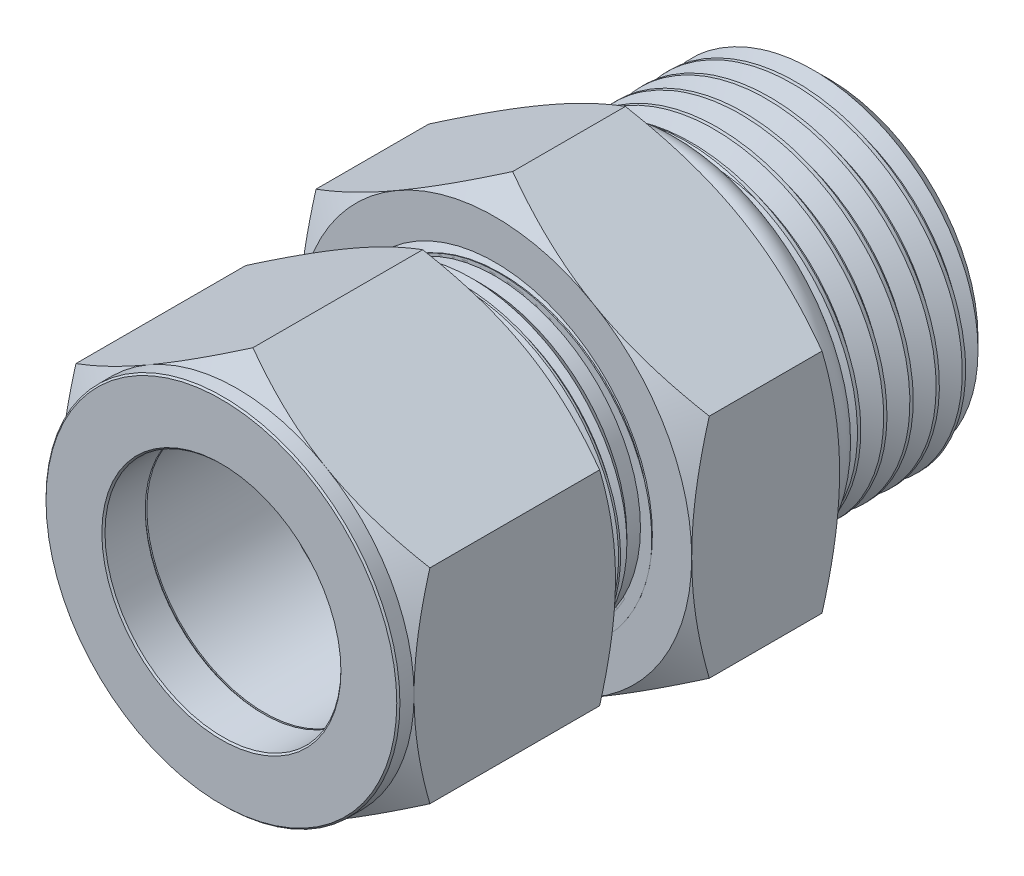
from build123d import *
from build123d.topology import SkipClean

# Parameters (mm, degrees)
BOSS_EXTRUDE1_DEPTH = 17.526
CHAMFER1_SIZE       = 0.127
SKETCH4_W           = 23.876
SKETCH4_H           = 12.7
BOSS_EXTRUDE2_DEPTH = 11.938
SKETCH11_W          = 14.986
SKETCH11_H          = 13.49375
SKETCH15_R          = 1.4732
SKETCH17_OUTSIDE_W  = 195.774
SKETCH17_OUTSIDE_H  = 200.686
SKETCH17_OUTSIDE_R  = 15.875
CUT_EXTRUDE1_DEPTH  = 42.790976949
CUT_EXTRUDE1_DRAFT  = -60
SKETCH18_OUTSIDE_W  = 176.526
SKETCH18_OUTSIDE_H  = 181.438
SKETCH18_OUTSIDE_R  = 15.875
CUT_EXTRUDE2_DEPTH  = 37.234489569
CUT_EXTRUDE2_DRAFT  = -60
CHAMFER2_SIZE       = 1.42875
CUT_SWEEP1_PITCH    = 1.27
CUT_SWEEP2_PITCH    = 2.116666667
SKETCH19_W          = 11.938
SKETCH19_H          = 0.824889197


with BuildPart() as part:
    # Sketch2 → Boss-Extrude1 (new body)
    with BuildSketch(Plane.XY):
        Polygon((0, 16.497783942), (-14.2875, 8.248891971), (-14.2875, -8.248891971), (0, -16.497783942), (14.2875, -8.248891971), (14.2875, 8.248891971), align=None)
    extrude(amount=-BOSS_EXTRUDE1_DEPTH)

    # Sketch3 → Cut-Revolve1 (revolve, cut)
    with BuildSketch(Plane(origin=(0, 0, 0), x_dir=(0, 0, -1), z_dir=(1, 0, 0)), mode=Mode.PRIVATE) as cut_revolve1_sk:
        Polygon((0, 16.497783942), (0, 14.2875), (1.27, 14.2875), (2.546108029, 16.497783942), (16.249891971, 16.497783942), (17.526, 14.2875), (17.526, 16.497783942), (17.526, 18.708067884), (0, 18.708067884), align=None)
        Polygon((0, 9.525), (0, 0), (17.526, 0), (17.526, 12.7), (7.0104, 12.7), (7.0104, 12.065), (3.5052, 12.065), (3.5052, 11.43), (3.5052, 9.525), align=None)
    revolve(cut_revolve1_sk.sketch.rotate(Axis((0, 0, 0), (0, 0, -1)), 90), axis=Axis((0, 0, 0), (0, 0, -1)), mode=Mode.SUBTRACT)

    # Chamfer1
    chamfer1_edges = [part.edges().sort_by_distance(p)[0] for p in [
        (-14.2875, 0, 0),
        (-9.525, 0, -3.5052),
        (-9.525, 0, 0),
    ]]
    chamfer(chamfer1_edges, length=CHAMFER1_SIZE)


with BuildPart() as body_2:
    # Sketch4 → Revolve1 (revolve)
    with BuildSketch(Plane(origin=(0, 0, 0), x_dir=(0, 0, -1), z_dir=(1, 0, 0)), mode=Mode.PRIVATE) as revolve1_sk:
        with Locations((22.098, 6.35)):
            Rectangle(SKETCH4_W, SKETCH4_H)
    revolve(revolve1_sk.sketch.rotate(Axis((0, 0, -34.036), (0, 0, 1)), 90), axis=Axis((0, 0, -34.036), (0, 0, 1)))


with BuildPart() as body_3:
    # Sketch7 → Boss-Extrude2 (new body)
    with BuildSketch(Plane(origin=(0, 0, -34.036), x_dir=(-1, 0, 0), z_dir=(0, 0, -1))):
        Polygon((0, 18.330871047), (-15.875, 9.165435523), (-15.875, -9.165435523), (0, -18.330871047), (15.875, -9.165435523), (15.875, 9.165435523), align=None)
    extrude(amount=-BOSS_EXTRUDE2_DEPTH)


with BuildPart() as body_4:
    # Sketch9 → Revolve2 (revolve)
    with BuildSketch(Plane(origin=(0, 0, 0), x_dir=(0, 0, -1), z_dir=(1, 0, 0)), mode=Mode.PRIVATE) as revolve2_sk:
        Polygon((6.1976, 11.8364), (6.1976, 10.6426), (7.3152, 9.525), (13.5128, 9.525), (13.5128, 10.0584), align=None)
    revolve(revolve2_sk.sketch.rotate(Axis((0, 0, 0), (0, 0, -1)), 90), axis=Axis((0, 0, 0), (0, 0, -1)))


with BuildPart() as body_5:
    # Sketch10 → Revolve3 (revolve)
    with BuildSketch(Plane(origin=(0, 0, 0), x_dir=(0, 0, -1), z_dir=(1, 0, 0)), mode=Mode.PRIVATE) as revolve3_sk:
        Polygon((3.5052, 11.0363), (4.7752, 11.0363), (4.7752, 10.6426), (6.1976, 10.6426), (7.3152, 9.525), (3.5052, 9.525), align=None)
    revolve(revolve3_sk.sketch.rotate(Axis((0, 0, 0), (0, 0, -1)), 90), axis=Axis((0, 0, 0), (0, 0, -1)))


with BuildPart() as body_6:
    # Sketch11 → Revolve4 (revolve)
    with BuildSketch(Plane(origin=(0, 0, 0), x_dir=(0, 0, -1), z_dir=(1, 0, 0)), mode=Mode.PRIVATE) as revolve4_sk:
        with Locations((41.529, 6.746875)):
            Rectangle(SKETCH11_W, SKETCH11_H)
    revolve(revolve4_sk.sketch.rotate(Axis((0, 0, -34.036), (0, 0, -1)), 90), axis=Axis((0, 0, -34.036), (0, 0, -1)))


with BuildPart() as body_7:
    # Sketch15 → Revolve5 (revolve)
    with BuildSketch(Plane(origin=(0, 0, 0), x_dir=(0, 0, -1), z_dir=(1, 0, 0)), mode=Mode.PRIVATE) as revolve5_sk:
        with Locations((35.5092, 13.208)):
            Circle(SKETCH15_R)
    revolve(revolve5_sk.sketch.rotate(Axis((0, 0, 0), (0, 0, -1)), 270), axis=Axis((0, 0, 0), (0, 0, -1)))


with BuildPart() as cut_extrude1_tool:
    # Sketch17 outside → Cut-Extrude1 (with draft: the straight prism first)
    with BuildSketch(Plane(origin=(0, 0, -34.036), x_dir=(-1, 0, 0), z_dir=(0, 0, -1))):
        Rectangle(SKETCH17_OUTSIDE_W, SKETCH17_OUTSIDE_H)
        Circle(SKETCH17_OUTSIDE_R, mode=Mode.SUBTRACT)
    extrude(amount=-CUT_EXTRUDE1_DEPTH)
    # Cut-Extrude1: the draft: its side faces are tilted about the plane it starts from
    cut_extrude1_sides = [cut_extrude1_tool.faces().sort_by_distance(p)[0] for p in [
        (0, -100.343, -12.640511526),
        (-97.887, 0, -12.640511526),
        (0, 100.343, -12.640511526),
        (97.887, 0, -12.640511526),
        (15.875, 0, -12.640511526),
    ]]
    draft(cut_extrude1_sides, Plane(origin=(0, 0, -34.036), x_dir=(-1, 0, 0), z_dir=(0, 0, -1)), CUT_EXTRUDE1_DRAFT)


with BuildPart() as body_3_1:
    add(body_3.part)

    # Cut-Extrude1: cut by cut_extrude1_tool
    add(cut_extrude1_tool.part, mode=Mode.SUBTRACT)


with BuildPart() as cut_extrude2_tool:
    # Sketch18 outside → Cut-Extrude2 (with draft: the straight prism first)
    with BuildSketch(Plane.XY.offset(-22.098)):
        Rectangle(SKETCH18_OUTSIDE_W, SKETCH18_OUTSIDE_H)
        Circle(SKETCH18_OUTSIDE_R, mode=Mode.SUBTRACT)
    extrude(amount=-CUT_EXTRUDE2_DEPTH)
    # Cut-Extrude2: the draft: its side faces are tilted about the plane it starts from
    cut_extrude2_sides = [cut_extrude2_tool.faces().sort_by_distance(p)[0] for p in [
        (0, -90.719, -40.715244785),
        (88.263, 0, -40.715244785),
        (0, 90.719, -40.715244785),
        (-88.263, 0, -40.715244785),
        (-15.875, 0, -40.715244785),
    ]]
    draft(cut_extrude2_sides, Plane.XY.offset(-22.098), CUT_EXTRUDE2_DRAFT)


with BuildPart() as body_3_2:
    add(body_3_1.part)

    # Cut-Extrude2: cut by cut_extrude2_tool
    add(cut_extrude2_tool.part, mode=Mode.SUBTRACT)


with BuildPart() as cut_revolve5_tool:
    # Sketch16 → Cut-Revolve5 (revolve)
    with BuildSketch(Plane(origin=(0, 0, 0), x_dir=(0, 0, -1), z_dir=(1, 0, 0))):
        Polygon((49.022, 0), (10.16, 0), (10.16, 10.873316667), (15.70736, 9.525), (24.384, 9.525), (24.384, 7.9375), (49.022, 7.9375), (50.6095, 7.9375), (50.6095, 0), align=None)
    revolve(axis=Axis((0, 0, -49.022), (0, 0, 1)))


with BuildPart() as body_3_3:
    add(body_3_2.part)

    # Cut-Revolve5: cut by cut_revolve5_tool
    add(cut_revolve5_tool.part, mode=Mode.SUBTRACT)

    # Sketch19 → Cut-Revolve7 (revolve, cut)
    with BuildSketch(Plane(origin=(0, 0, 0), x_dir=(0, 0, -1), z_dir=(1, 0, 0)), mode=Mode.PRIVATE) as cut_revolve7_sk:
        with Locations((28.067, 12.287555402)):
            Rectangle(SKETCH19_W, SKETCH19_H)
    revolve(cut_revolve7_sk.sketch.rotate(Axis((0, 0, 0), (0, 0, -1)), 90), axis=Axis((0, 0, 0), (0, 0, -1)), mode=Mode.SUBTRACT)


with BuildPart() as body_2_1:
    add(body_2.part)

    # Cut-Revolve5: cut by cut_revolve5_tool
    add(cut_revolve5_tool.part, mode=Mode.SUBTRACT)

    # Cut-Sweep1: the profile of Sketch6 screwed along a right-hand helix of 19.8 turns, 8 arcs to a turn; built about Z, then put on its axis
    cut_sweep1_z = Axis((0, 0, 0), (0, 0, 1))
    cut_sweep1_corners = [(11.875110803, 0, -0.635), (12.768740766, 0, -1.1509375), (12.768740766, 0, 0.0396875), (11.875110803, 0, -0.47625)]
    with BuildLine(mode=Mode.PRIVATE) as cut_sweep1_profile:
        Line(cut_sweep1_corners[0], cut_sweep1_corners[1])
        Line(cut_sweep1_corners[1], cut_sweep1_corners[2])
        Line(cut_sweep1_corners[2], cut_sweep1_corners[3])
        Line(cut_sweep1_corners[3], cut_sweep1_corners[0])
    cut_sweep1_cap = Face(cut_sweep1_profile.wire())
    cut_sweep1_turn_angles = [0, 22.5, 45, 67.5, 90, 112.5, 135, 157.5, 180, 202.5, 225, 247.5, 270, 292.5, 315, 337.5, 360]
    cut_sweep1_turn_weights = [1, 0.9238795325112867, 1, 0.9238795325112867, 1, 0.9238795325112867, 1, 0.9238795325112867, 1, 0.9238795325112867, 1, 0.9238795325112867, 1, 0.9238795325112867, 1, 0.9238795325112867, 1]
    cut_sweep1_turn_rails = [Edge.make_bspline([Vector(p[0], p[1], 0).rotate(cut_sweep1_z, cut_sweep1_turn_angles[k]) / cut_sweep1_turn_weights[k] + Vector(0, 0, p[2] + CUT_SWEEP1_PITCH * cut_sweep1_turn_angles[k] / 360) for k in range(17)], [0, 0, 0, 1, 1, 2, 2, 3, 3, 4, 4, 5, 5, 6, 6, 7, 7, 8, 8, 8], 2, cut_sweep1_turn_weights) for p in cut_sweep1_corners]
    cut_sweep1_turn_sides = [Face.make_surface_from_curves(cut_sweep1_turn_rails[p[0]], cut_sweep1_turn_rails[p[1]]) for p in [(0, 1), (1, 2), (2, 3), (3, 0)]]
    cut_sweep1_last_angles = [6840, 6862.5, 6885, 6907.5, 6930, 6952.5, 6975, 6997.5, 7020, 7042.5, 7065, 7087.5, 7110, 7119, 7128]
    cut_sweep1_last_weights = [1, 0.9238795325112867, 1, 0.9238795325112867, 1, 0.9238795325112867, 1, 0.9238795325112867, 1, 0.9238795325112867, 1, 0.9238795325112867, 1, 0.9876883405950968, 1]
    cut_sweep1_last_rails = [Edge.make_bspline([Vector(p[0], p[1], 0).rotate(cut_sweep1_z, cut_sweep1_last_angles[k]) / cut_sweep1_last_weights[k] + Vector(0, 0, p[2] + CUT_SWEEP1_PITCH * cut_sweep1_last_angles[k] / 360) for k in range(15)], [0, 0, 0, 1, 1, 2, 2, 3, 3, 4, 4, 5, 5, 6, 6, 7, 7, 7], 2, cut_sweep1_last_weights) for p in cut_sweep1_corners]
    cut_sweep1_last_sides = [Face.make_surface_from_curves(cut_sweep1_last_rails[p[0]], cut_sweep1_last_rails[p[1]]) for p in [(0, 1), (1, 2), (2, 3), (3, 0)]]
    cut_sweep1 = Plane(origin=(0, 0, -10.16), x_dir=(0, 1, 0), z_dir=(0, 0, -1)) * Solid(Shell([*[p.moved(Location((0, 0, CUT_SWEEP1_PITCH * i))) for i in range(19) for p in cut_sweep1_turn_sides], *cut_sweep1_last_sides, cut_sweep1_cap, cut_sweep1_cap.rotate(cut_sweep1_z, 7128).moved(Location((0, 0, CUT_SWEEP1_PITCH * 7128 / 360)))]))
    add(cut_sweep1, mode=Mode.SUBTRACT)

    # Sketch8 → Cut-Revolve2 (revolve, cut)
    with BuildSketch(Plane(origin=(0, 0, 0), x_dir=(0, 0, -1), z_dir=(1, 0, 0)), mode=Mode.PRIVATE) as cut_revolve2_sk:
        Polygon((10.16, 12.837481533), (10.16, 11.73762927), (11.259852263, 12.837481533), align=None)
        Polygon((22.098, 12.837481533), (19.898295474, 12.837481533), (20.998147737, 11.73762927), (22.098, 11.73762927), align=None)
    revolve(cut_revolve2_sk.sketch.rotate(Axis((0, 0, 0), (0, 0, -1)), 90), axis=Axis((0, 0, 0), (0, 0, -1)), mode=Mode.SUBTRACT)


with BuildPart() as body_6_1:
    add(body_6.part)

    # Cut-Revolve5: cut by cut_revolve5_tool
    add(cut_revolve5_tool.part, mode=Mode.SUBTRACT)

    # Chamfer2
    chamfer2_edges = [body_6_1.edges().sort_by_distance(p)[0] for p in [
        (-13.49375, 0, -49.022),
    ]]
    chamfer(chamfer2_edges, length=CHAMFER2_SIZE)

    # Cut-Sweep2: the profile of Sketch13 screwed along a right-hand helix of 8.08 turns, 10 arcs to a turn; built about Z, then put on its axis
    cut_sweep2_z = Axis((0, 0, 0), (0, 0, 1))
    cut_sweep2_corners = [(13.722885888, 0, 0.132291667), (13.608317944, 0, -1.918229167), (12.118934671, 0, -1.058333333), (12.118934671, 0, -0.79375)]
    with BuildLine(mode=Mode.PRIVATE) as cut_sweep2_profile:
        Line(cut_sweep2_corners[0], cut_sweep2_corners[1])
        Line(cut_sweep2_corners[1], cut_sweep2_corners[2])
        Line(cut_sweep2_corners[2], cut_sweep2_corners[3])
        Line(cut_sweep2_corners[3], cut_sweep2_corners[0])
    cut_sweep2_cap = Face(cut_sweep2_profile.wire())
    cut_sweep2_turn_angles = [0, 18, 36, 54, 72, 90, 108, 126, 144, 162, 180, 198, 216, 234, 252, 270, 288, 306, 324, 342, 360]
    cut_sweep2_turn_weights = [1, 0.9510565162951535, 1, 0.9510565162951535, 1, 0.9510565162951535, 1, 0.9510565162951535, 1, 0.9510565162951535, 1, 0.9510565162951535, 1, 0.9510565162951535, 1, 0.9510565162951535, 1, 0.9510565162951535, 1, 0.9510565162951535, 1]
    cut_sweep2_turn_rails = [Edge.make_bspline([Vector(p[0], p[1], 0).rotate(cut_sweep2_z, cut_sweep2_turn_angles[k]) / cut_sweep2_turn_weights[k] + Vector(0, 0, p[2] + CUT_SWEEP2_PITCH * cut_sweep2_turn_angles[k] / 360) for k in range(21)], [0, 0, 0, 1, 1, 2, 2, 3, 3, 4, 4, 5, 5, 6, 6, 7, 7, 8, 8, 9, 9, 10, 10, 10], 2, cut_sweep2_turn_weights) for p in cut_sweep2_corners]
    cut_sweep2_turn_sides = [Face.make_surface_from_curves(cut_sweep2_turn_rails[p[0]], cut_sweep2_turn_rails[p[1]]) for p in [(0, 1), (1, 2), (2, 3), (3, 0)]]
    cut_sweep2_last_angles = [2880, 2894.4, 2908.8]
    cut_sweep2_last_weights = [1, 0.9685831611285843, 1]
    cut_sweep2_last_rails = [Edge.make_bspline([Vector(p[0], p[1], 0).rotate(cut_sweep2_z, cut_sweep2_last_angles[k]) / cut_sweep2_last_weights[k] + Vector(0, 0, p[2] + CUT_SWEEP2_PITCH * cut_sweep2_last_angles[k] / 360) for k in range(3)], [0, 0, 0, 1, 1, 1], 2, cut_sweep2_last_weights) for p in cut_sweep2_corners]
    cut_sweep2_last_sides = [Face.make_surface_from_curves(cut_sweep2_last_rails[p[0]], cut_sweep2_last_rails[p[1]]) for p in [(0, 1), (1, 2), (2, 3), (3, 0)]]
    cut_sweep2 = Plane(origin=(0, 0, -50.292), x_dir=(0, 1, 0), z_dir=(0, 0, 1)) * Solid(Shell([*[p.moved(Location((0, 0, CUT_SWEEP2_PITCH * i))) for i in range(8) for p in cut_sweep2_turn_sides], *cut_sweep2_last_sides, cut_sweep2_cap, cut_sweep2_cap.rotate(cut_sweep2_z, 2908.8).moved(Location((0, 0, CUT_SWEEP2_PITCH * 2908.8 / 360)))]))
    add(cut_sweep2, mode=Mode.SUBTRACT)

    # Sketch14 → Cut-Revolve4 (revolve, cut)
    with SkipClean():  # the faces are left unmerged after this step: merging them gives an invalid solid
        with BuildSketch(Plane(origin=(0, 0, 0), x_dir=(0, 0, -1), z_dir=(1, 0, 0)), mode=Mode.PRIVATE) as cut_revolve4_sk:
            Polygon((37.702174209, 13.722885888), (34.036, 13.722885888), (34.036, 11.889798783), (35.869087105, 11.889798783), align=None)
        revolve(cut_revolve4_sk.sketch.rotate(Axis((0, 0, 0), (0, 0, -1)), 285.881976429), axis=Axis((0, 0, 0), (0, 0, -1)), mode=Mode.SUBTRACT)


with BuildPart() as part_1:
    add(part.part)

    # Combine3: union body 5, body 4
    add(body_5.part)
    add(body_4.part)


with BuildPart() as cut_revolve7_piece_1:
    # of the separate pieces the step leaves, piece 1, a body of its own (cut_revolve7_pieces)
    add(body_3_3.part.solids().sort_by_distance((0, 18.330871047, -32.61810219))[0])


with BuildPart() as cut_revolve7_piece_2:
    # of the separate pieces the step leaves, piece 2, a body of its own (cut_revolve7_pieces)
    add(body_3_3.part.solids().sort_by_distance((11.875110803, 0, -34.036))[0])


solid = Compound([body_7.part, body_2_1.part, body_6_1.part, part_1.part, cut_revolve7_piece_1.part, cut_revolve7_piece_2.part])
